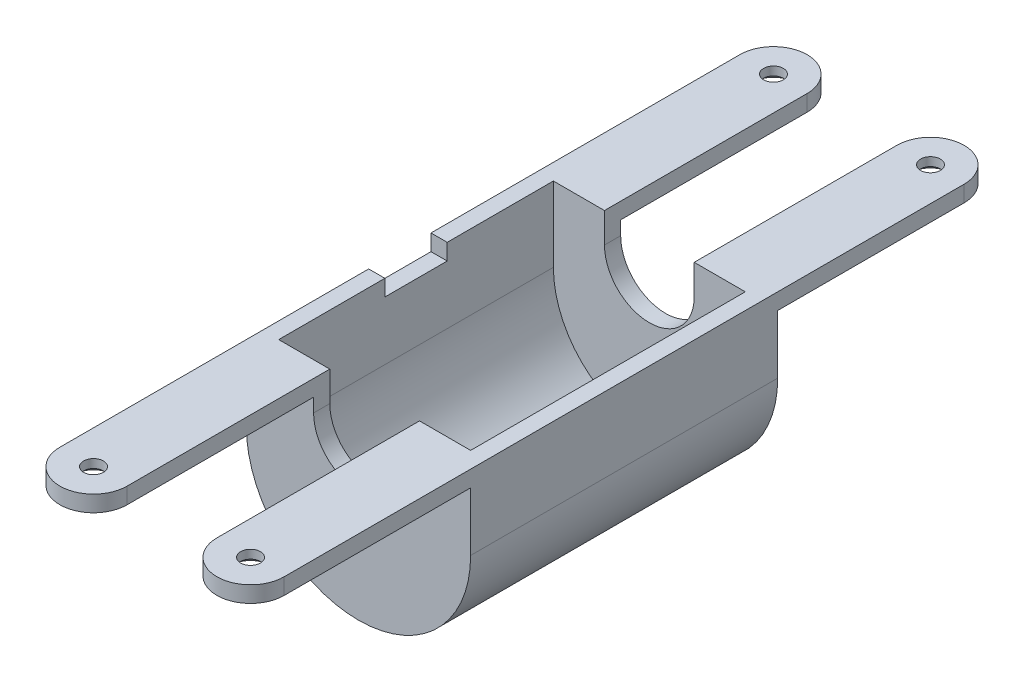
from build123d import *

# Parameters (mm, degrees)
BOSS_EXTRUDE2_DEPTH = 78.232
SHELL1_T            = -8.255
SKETCH2_W           = 31.75
SKETCH2_H           = 8.255
CUT_EXTRUDE1_DEPTH  = 8.255
SKETCH3_W           = 34.29
SKETCH3_H           = 8.255
BOSS_EXTRUDE3_DEPTH = 112.141
CUT_EXTRUDE2_START  = -8.255
CUT_EXTRUDE2_DEPTH  = 8.255


# Read off the part's stored shape, not the designer's step: Cut-Extrude2
with BuildPart() as part:
    # Sketch1 → Boss-Extrude2 (new, symmetric)
    with BuildSketch(Plane.XY):
        with BuildLine():
            Line((22.86, 38.1), (57.15, 38.1))
            Line((57.15, 38.1), (57.15, 0))
            ThreePointArc((57.15, 0), (0, -57.15), (-57.15, 0))
            Line((-57.15, 0), (-57.15, 38.1))
            Line((-57.15, 38.1), (-22.86, 38.1))
            Line((-22.86, 38.1), (-22.86, 22.86))
            ThreePointArc((-22.86, 22.86), (0, 0), (22.86, 22.86))
            Line((22.86, 22.86), (22.86, 38.1))
        make_face()
    extrude(amount=BOSS_EXTRUDE2_DEPTH, both=True)

    # Shell1
    shell1_openings = [part.faces().sort_by_distance(p)[0] for p in [
        (40.005, 38.1, 0),
        (-40.005, 38.1, 0),
        (-22.86, 30.48, 0),
        (0, 0, 0),
        (22.86, 30.48, 0),
    ]]
    offset(amount=SHELL1_T, openings=shell1_openings, kind=Kind.INTERSECTION)

    # Sketch2 → Cut-Extrude1 (cut)
    with BuildSketch(Plane(origin=(-48.895, 0, 0), x_dir=(0, 0, -1), z_dir=(1, 0, 0))):
        with Locations((0, 33.9725)):
            Rectangle(SKETCH2_W, SKETCH2_H)
    extrude(amount=-CUT_EXTRUDE1_DEPTH, mode=Mode.SUBTRACT)


with BuildPart() as body_2:
    # Sketch3 → Boss-Extrude3 (new body)
    with BuildSketch(Plane.XY.offset(78.232)):
        with Locations((-40.005, 33.9725)):
            Rectangle(SKETCH3_W, SKETCH3_H)
    extrude(amount=BOSS_EXTRUDE3_DEPTH)

    # Cut-Extrude2 outline → Cut-Extrude2 (cut)
    with BuildSketch(Plane(origin=(0, 38.1, 0), x_dir=(1, 0, 0), z_dir=(0, 1, 0)).offset(CUT_EXTRUDE2_START)):
        with BuildLine():
            Line((-22.86, -190.373), (-22.86, -173.228))
            ThreePointArc((-22.86, -173.228), (-27.881654237, -185.351345763), (-40.005, -190.373))
            Line((-40.005, -190.373), (-22.86, -190.373))
        make_face()
        with BuildLine():
            Line((-57.15, -190.373), (-40.005, -190.373))
            ThreePointArc((-40.005, -190.373), (-52.128345763, -185.351345763), (-57.15, -173.228))
            Line((-57.15, -173.228), (-57.15, -190.373))
        make_face()
    extrude(amount=CUT_EXTRUDE2_DEPTH, mode=Mode.SUBTRACT)

    # Sketch7 → CSK for 3/8 Flat Head Machine Screw (100)1 (revolve, cut)
    with BuildSketch(Plane(origin=(-40.005, 29.845, 173.228), x_dir=(0, 0, -1), z_dir=(1, 0, 0))):
        Polygon((0, 0), (0, 8.255), (5.0419, 8.255), (5.0419, 3.88964634), (9.6774, 0), align=None)
    revolve(axis=Axis((-40.005, 23.495, 173.228), (0, 1, 0)), mode=Mode.SUBTRACT)


with BuildPart() as body_3:
    # Mirror2: mirrored copy
    add(body_2.part.mirror(Plane(origin=(0, 0, 0), x_dir=(0, 0, 1), z_dir=(1, 0, 0))))


with BuildPart() as body_4:
    # Mirror3: mirrored copy
    add(body_2.part.mirror(Plane.XY))


with BuildPart() as body_5:
    # Mirror3 2: mirrored copy
    add(body_3.part.mirror(Plane.XY))


with BuildPart() as body_2_1:
    add(body_2.part)

    # Combine2: union body 3, body 4, body 5, part
    add(body_3.part)
    add(body_4.part)
    add(body_5.part)
    add(part.part)


solid = body_2_1.part
